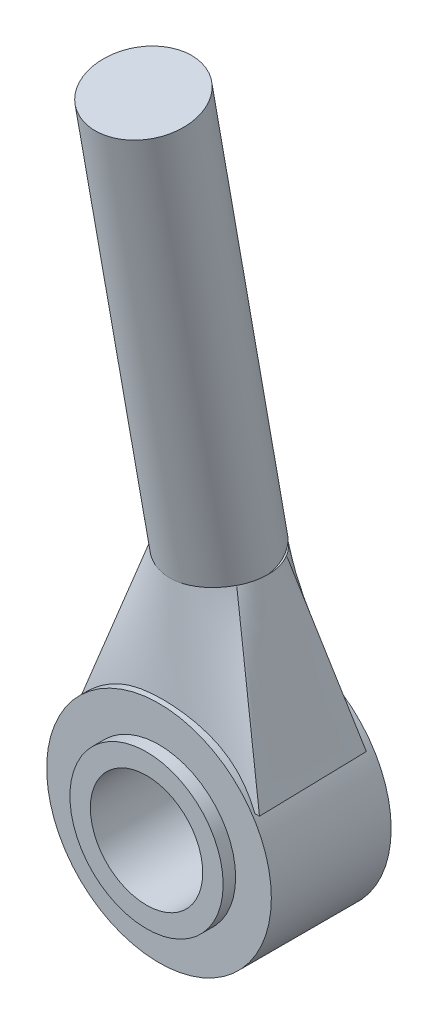
from build123d import *

# Parameters (mm, degrees)
SKETCH1_R               = 18
BOSS_EXTRUDE1_DEPTH     = 19.2
SKETCH2_R               = 12.276458432
SKETCH2_R_2             = 8.347690183
BOSS_EXTRUDE2_DEPTH     = 2
SKETCH3_R               = 8.347690183
BOSS_EXTRUDE4_DEPTH     = 6.8
FILLET1_R               = 4
SKETCH13_R              = 9
CUT_EXTRUDE4_DEPTH      = 50
BOSS_EXTRUDE6_START     = 36.124968835
BOSS_EXTRUDE6_OUTLINE_R = 7.85
BOSS_EXTRUDE6_DEPTH     = 70


with BuildPart() as part:
    # Sketch1 → Boss-Extrude1 (new body)
    with BuildSketch(Plane.XY):
        Circle(SKETCH1_R)
    extrude(amount=BOSS_EXTRUDE1_DEPTH)

    # Sketch2 → Boss-Extrude2 (add)
    with BuildSketch(Plane.XY.offset(19.2)):
        Circle(SKETCH2_R)
        Circle(SKETCH2_R_2, mode=Mode.SUBTRACT)
    extrude(amount=BOSS_EXTRUDE2_DEPTH)

    # Sketch3 → Boss-Extrude4 (add)
    with BuildSketch(Plane.XY.offset(19.2)):
        Circle(SKETCH3_R)
    extrude(amount=BOSS_EXTRUDE4_DEPTH)

    # Fillet1
    fillet1_edges = [part.edges().sort_by_distance(p)[0] for p in [
        (-8.347690183, 0, 26),
    ]]
    fillet(fillet1_edges, radius=FILLET1_R)

    # Loft5: read off the stored shape, not the designer's step
    # Loft5: loft between two sections, ruled curve by curve
    loft5_from = [
        Edge.make_bspline([(-13.870540046, 10, 1.272084055), (-13.870540046, 10, 2.733260237), (-13.870540046, 10, 4.19443642), (-13.870540046, 10, 7.116788785), (-13.870540046, 10, 8.577964967), (-13.870540046, 10, 11.500317332), (-13.870540046, 10, 12.961493515), (-13.870540046, 10, 15.88384588), (-13.870540046, 10, 17.345022062), (-13.870540046, 10, 18.806198245)], [0, 0, 0, 0, 0.25, 0.25, 0.5, 0.5, 0.75, 0.75, 1, 1, 1, 1], 3),
        Edge.make_bspline([(-13.870540046, 10, 18.806198245), (-12.638187033, 10, 18.806198245), (-11.40583402, 10, 18.806198245), (-8.941127993, 10, 18.806198245), (-7.70877498, 10, 18.806198245), (-5.244068953, 10, 18.806198245), (-4.01171594, 10, 18.806198245), (-1.547009913, 10, 18.806198245), (-0.3146569, 10, 18.806198245), (2.150049127, 10, 18.806198245), (3.38240214, 10, 18.806198245), (5.847108167, 10, 18.806198245), (7.07946118, 10, 18.806198245), (9.544167207, 10, 18.806198245), (10.77652022, 10, 18.806198245), (13.241226247, 10, 18.806198245), (14.47357926, 10, 18.806198245), (15.705932273, 10, 18.806198245)], [0, 0, 0, 0, 0.125, 0.125, 0.25, 0.25, 0.375, 0.375, 0.5, 0.5, 0.625, 0.625, 0.75, 0.75, 0.875, 0.875, 1, 1, 1, 1], 3),
        Edge.make_bspline([(15.293044741, 10, 1.272084055), (14.077895375, 10, 1.272084055), (12.862746008, 10, 1.272084055), (10.432447276, 10, 1.272084055), (9.21729791, 10, 1.272084055), (6.786999178, 10, 1.272084055), (5.571849812, 10, 1.272084055), (3.141551079, 10, 1.272084055), (1.926401713, 10, 1.272084055), (-0.503897019, 10, 1.272084055), (-1.719046385, 10, 1.272084055), (-4.149345117, 10, 1.272084055), (-5.364494484, 10, 1.272084055), (-7.794793216, 10, 1.272084055), (-9.009942582, 10, 1.272084055), (-11.440241314, 10, 1.272084055), (-12.65539068, 10, 1.272084055), (-13.870540046, 10, 1.272084055)], [0, 0, 0, 0, 0.125, 0.125, 0.25, 0.25, 0.375, 0.375, 0.5, 0.5, 0.625, 0.625, 0.75, 0.75, 0.875, 0.875, 1, 1, 1, 1], 3),
        Edge.make_bspline([(15.705932273, 10, 18.806198245), (15.671524979, 10, 17.345022062), (15.637117685, 10, 15.88384588), (15.568303096, 10, 12.961493515), (15.533895801, 10, 11.500317332), (15.465081213, 10, 8.577964967), (15.430673918, 10, 7.116788785), (15.361859329, 10, 4.19443642), (15.327452035, 10, 2.733260237), (15.293044741, 10, 1.272084055)], [0, 0, 0, 0, 0.25, 0.25, 0.5, 0.5, 0.75, 0.75, 1, 1, 1, 1], 3),
    ]
    loft5_to = [
        Edge.make_bspline([(-6.740203008, 35, 5.516591807), (-7.083985671, 35, 6.09243536), (-7.365341755, 35, 6.734156051), (-7.74869442, 35, 8.097700335), (-7.85, 35, 8.818869121), (-7.85, 35, 10.26221196), (-7.74869442, 35, 10.983380746), (-7.365341755, 35, 12.34692503), (-7.083985671, 35, 12.988645721), (-6.740203008, 35, 13.564489274)], [0, 0, 0, 0, 0.25, 0.25, 0.5, 0.5, 0.75, 0.75, 1, 1, 1, 1], 3),
        Edge.make_bspline([(-6.740203008, 35, 13.564489274), (-6.451756257, 35, 14.047643954), (-6.092847535, 35, 14.530224597), (-5.218696772, 35, 15.438416605), (-4.702923047, 35, 15.863536141), (-3.528860323, 35, 16.586454489), (-2.870504053, 35, 16.883315453), (-1.466341415, 35, 17.286893217), (-0.721281456, 35, 17.392785885), (0.769354223, 35, 17.388221597), (1.513751736, 35, 17.277768249), (2.915416578, 35, 16.865599114), (3.57194256, 35, 16.564712015), (4.741556195, 35, 15.834617391), (5.254716863, 35, 15.406347285), (6.123289567, 35, 14.492819102), (6.479236287, 35, 14.00804959), (6.764718843, 35, 13.523137554)], [0, 0, 0, 0, 0.125, 0.125, 0.25, 0.25, 0.375, 0.375, 0.5, 0.5, 0.625, 0.625, 0.75, 0.75, 0.875, 0.875, 1, 1, 1, 1], 3),
        Edge.make_bspline([(6.714912928, 35, 5.474529674), (6.424525906, 35, 4.994962936), (6.064332724, 35, 4.516631942), (5.189797582, 35, 3.61755227), (4.674946594, 35, 3.197289059), (3.505304255, 35, 2.483288448), (2.850457816, 35, 2.190459602), (1.45515568, 35, 1.792552317), (0.715425599, 35, 1.688265686), (-0.76450524, 35, 1.692892109), (-1.503568847, 35, 1.801801607), (-2.896355935, 35, 2.208424757), (-3.549358764, 35, 2.50534208), (-4.714514202, 35, 3.226641519), (-5.226727577, 35, 3.650115443), (-6.095624443, 35, 4.55464527), (-6.452819986, 35, 5.035218898), (-6.740203008, 35, 5.516591807)], [0, 0, 0, 0, 0.125, 0.125, 0.25, 0.25, 0.375, 0.375, 0.5, 0.5, 0.625, 0.625, 0.75, 0.75, 0.875, 0.875, 1, 1, 1, 1], 3),
        Edge.make_bspline([(6.764718843, 35, 13.523137554), (7.105005207, 35, 12.945137428), (7.382450639, 35, 12.301626641), (7.757449733, 35, 10.935584457), (7.854315981, 35, 10.21371246), (7.845383427, 35, 8.770216678), (7.739590849, 35, 8.049598762), (7.347714599, 35, 6.68830211), (7.062326449, 35, 6.048274216), (6.714912928, 35, 5.474529674)], [0, 0, 0, 0, 0.25, 0.25, 0.5, 0.5, 0.75, 0.75, 1, 1, 1, 1], 3),
    ]
    loft5 = Solid(Shell([*[Face.make_surface_from_curves(loft5_from[k], loft5_to[k]) for k in range(4)], Face(Wire(loft5_from)), Face(Wire(loft5_to))]))
    add(loft5)

    # Sketch13 → Cut-Extrude4 (cut)
    with BuildSketch(Plane(origin=(0, 0, 0), x_dir=(-1, 0, 0), z_dir=(0, 0, -1))):
        Circle(SKETCH13_R)
    extrude(amount=-CUT_EXTRUDE4_DEPTH, mode=Mode.SUBTRACT)


with BuildPart() as boss_extrude6_tool:
    # Boss-Extrude6: read off the stored shape, not the designer's step
    # Boss-Extrude6 outline → Boss-Extrude6 (new body)
    with BuildSketch(Plane(origin=(0, 0, 0), x_dir=(1, 0, 0), z_dir=(0, 0.9848077530122076, 0.1736481776669339)).offset(BOSS_EXTRUDE6_START)):
        with Locations((0, -3.317912074)):
            Circle(BOSS_EXTRUDE6_OUTLINE_R)
    extrude(amount=BOSS_EXTRUDE6_DEPTH)


with BuildPart() as part_1:
    add(part.part)


with BuildPart() as part_2:
    # Boss-Extrude6: joined with boss_extrude6_tool
    add(part_1.part.fuse(boss_extrude6_tool.part, tol=0.00001))


solid = part_2.part
